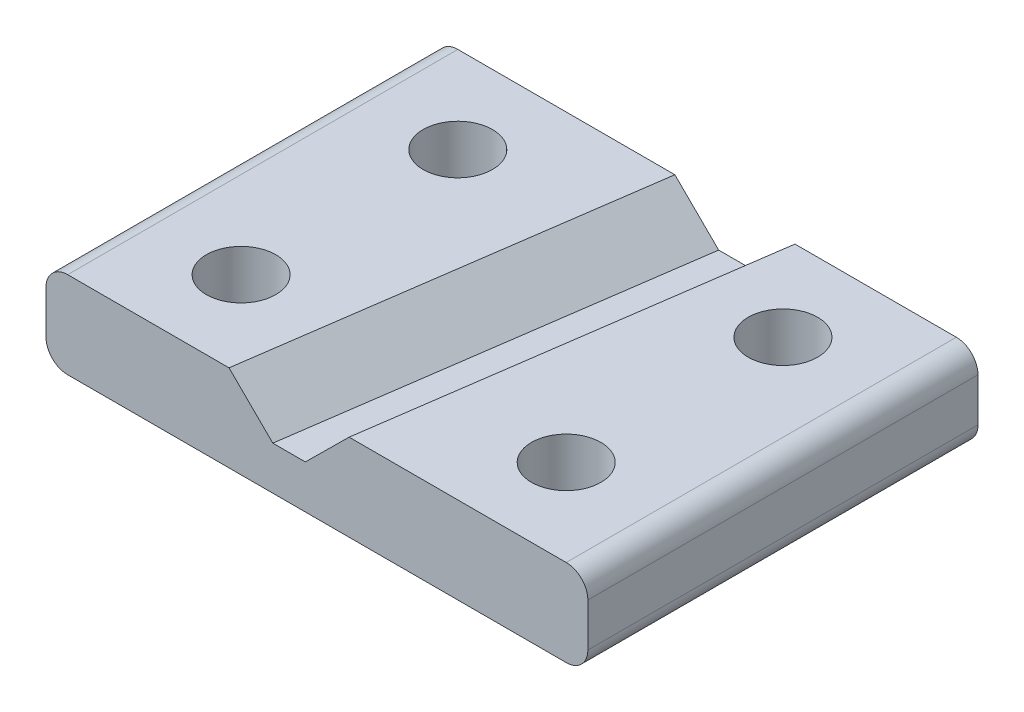
from build123d import *

# Parameters (mm, degrees)
SKETCH_1_W          = 25
SKETCH_1_H          = 4
EXTRUDE_1_DEPTH     = 18
FILLET_1_R          = 1
SKETCH_3_R          = 1.6
CUT_EXTRUDE_2_DEPTH = 23.27666941
CUT_EXTRUDE_3_DEPTH = 2
CHAMFER_2_SIZE      = 3.5
CHAMFER_3_SIZE      = 3.5


with BuildPart() as part:
    # 草图1 → 凸台-拉伸1 (new body)
    with BuildSketch(Plane.XY):
        Rectangle(SKETCH_1_W, SKETCH_1_H)
    extrude(amount=EXTRUDE_1_DEPTH)

    # 圆角1
    fillet_1_edges = [part.edges().sort_by_distance(p)[0] for p in [
        (-12.5, 2, 9),
        (12.5, 2, 9),
        (12.5, -2, 9),
        (-12.5, -2, 9),
    ]]
    fillet(fillet_1_edges, radius=FILLET_1_R)

    # 草图3 → 切除-拉伸2 (cut, through all)
    with BuildSketch(Plane.XZ.offset(2)):
        with Locations((-7.5, 14)):
            Circle(SKETCH_3_R)
        with Locations((-7.5, 4)):
            Circle(SKETCH_3_R)
        with Locations(Location((7.5, 4, 0), (0, 0, 180))):
            Circle(SKETCH_3_R)
        with Locations(Location((7.5, 14, 0), (0, 0, 180))):
            Circle(SKETCH_3_R)
    extrude(amount=-CUT_EXTRUDE_2_DEPTH, mode=Mode.SUBTRACT)

    # 草图4 → 切除-拉伸3 (cut)
    with BuildSketch(Plane(origin=(0, 2, 0), x_dir=(1, 0, 0), z_dir=(0, 1, 0))):
        Polygon((5.570878435, 0), (3, -18), (-5.570878435, -18), (-3, 0), align=None)
    extrude(amount=-CUT_EXTRUDE_3_DEPTH, mode=Mode.SUBTRACT)

    # 倒角2
    # the kernel refuses this chamfer: 3.5 mm, written as the material it adds along each edge
    with BuildSketch(Plane(origin=(6.843529685, 0, -8.910465074), x_dir=(0.027219645584784704, 0.9996219169112968, 0.00388768887943796), z_dir=(-0.14139170518175465, 0, 0.9899537290731298))) as chamfer_2_piece_1_section:
        Polygon((CHAMFER_2_SIZE * 0.999621916911, CHAMFER_2_SIZE * 0.0274958766106), (-CHAMFER_2_SIZE * 0.0274958766106, CHAMFER_2_SIZE * 0.999621916911), (0, 0), align=None)
    chamfer_2_piece_1 = extrude(amount=36.184448925, mode=Mode.PRIVATE)
    chamfer_2_piece_1 = split(chamfer_2_piece_1, bisect_by=Plane(origin=(2.941803391, 0.818076093, 0), z_dir=(0, 0, 1)), keep=Keep.TOP, mode=Mode.PRIVATE)
    chamfer_2_piece_1 = split(chamfer_2_piece_1, bisect_by=Plane(origin=(2.941803391, 0.818076093, 18), z_dir=(0, 0, -1)), keep=Keep.TOP, mode=Mode.PRIVATE)
    chamfer_2_piece_1 = split(chamfer_2_piece_1, bisect_by=Plane(origin=(2.941803391, 2, 9), z_dir=(0, -1, 0)), keep=Keep.TOP, mode=Mode.PRIVATE)
    add(chamfer_2_piece_1)

    # 倒角3
    # the kernel refuses this chamfer: 3.5 mm, written as the material it adds along each edge
    with BuildSketch(Plane(origin=(-6.843529685, 0, 26.910465074), x_dir=(-0.02721964558478464, 0.9996219169112968, -0.003887688879437917), z_dir=(0.14139170518175467, 0, -0.9899537290731298))) as chamfer_3_piece_1_section:
        Polygon((CHAMFER_3_SIZE * 0.999621916911, CHAMFER_3_SIZE * 0.0274958766106), (-CHAMFER_3_SIZE * 0.0274958766106, CHAMFER_3_SIZE * 0.999621916911), (0, 0), align=None)
    chamfer_3_piece_1 = extrude(amount=36.184448925, mode=Mode.PRIVATE)
    chamfer_3_piece_1 = split(chamfer_3_piece_1, bisect_by=Plane(origin=(-2.941803391, 2, 9), z_dir=(0, -1, 0)), keep=Keep.TOP, mode=Mode.PRIVATE)
    chamfer_3_piece_1 = split(chamfer_3_piece_1, bisect_by=Plane(origin=(-2.941803391, 0.818076093, 18), z_dir=(0, 0, -1)), keep=Keep.TOP, mode=Mode.PRIVATE)
    chamfer_3_piece_1 = split(chamfer_3_piece_1, bisect_by=Plane(origin=(-2.941803391, 0.818076093, 0), z_dir=(0, 0, 1)), keep=Keep.TOP, mode=Mode.PRIVATE)
    add(chamfer_3_piece_1)


solid = part.part
